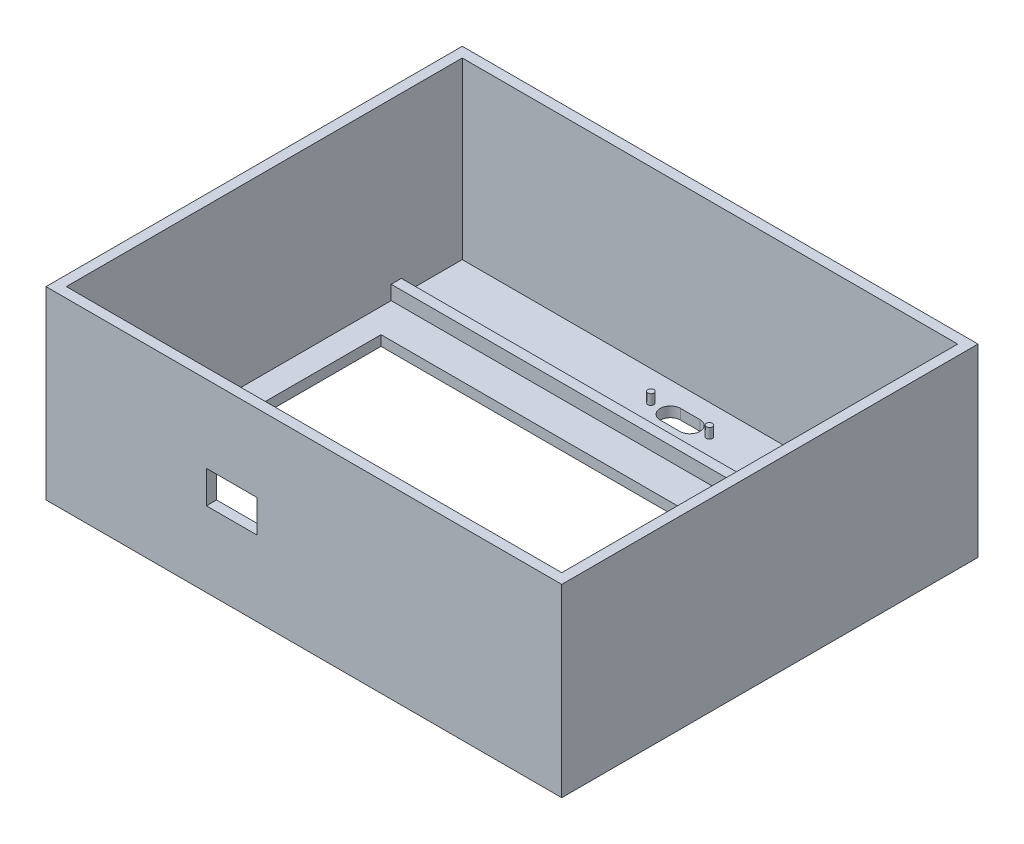
from build123d import *

# Parameters (mm, degrees)
SKETCH1_W           = 127
SKETCH1_H           = 85
BOSS_EXTRUDE1_DEPTH = 2.5
SKETCH2_W           = 127
SKETCH2_H           = 85
SKETCH2_W_2         = 122
SKETCH2_H_2         = 80
BOSS_EXTRUDE2_DEPTH = 38.5
SKETCH3_W           = 110
SKETCH3_H           = 68.5
CUT_EXTRUDE1_DEPTH  = 2.5
BOSS_EXTRUDE3_DEPTH = 15
SKETCH10_W          = 122
SKETCH10_H          = 2.5
CUT_EXTRUDE2_DEPTH  = 35
SKETCH11_W          = 127
SKETCH11_H          = 41
BOSS_EXTRUDE4_DEPTH = 2.5
CUT_EXTRUDE4_DEPTH  = 2.5
SKETCH14_W          = 15
SKETCH14_H          = 1
CUT_EXTRUDE5_DEPTH  = 1.5
SKETCH13_R          = 0.75
BOSS_EXTRUDE6_DEPTH = 2.5
SKETCH17_W          = 12.5
SKETCH17_H          = 8
CUT_EXTRUDE6_DEPTH  = 2.5
SKETCH19_W          = 127
SKETCH19_H          = 102.5
SKETCH19_W_2        = 122
SKETCH19_H_2        = 97.5
BOSS_EXTRUDE7_DEPTH = 4.5


with BuildPart() as part:
    # Sketch1 → Boss-Extrude1 (new body)
    with BuildSketch(Plane(origin=(0, 0, 0), x_dir=(1, 0, 0), z_dir=(0, 1, 0))):
        with Locations((63.5, 42.5)):
            Rectangle(SKETCH1_W, SKETCH1_H)
    extrude(amount=BOSS_EXTRUDE1_DEPTH)

    # Sketch2 → Boss-Extrude2 (add)
    with BuildSketch(Plane(origin=(0, 2.5, 0), x_dir=(1, 0, 0), z_dir=(0, 1, 0))):
        with Locations((63.5, 42.5)):
            Rectangle(SKETCH2_W, SKETCH2_H)
        with Locations((63.5, 42.5)):
            Rectangle(SKETCH2_W_2, SKETCH2_H_2, mode=Mode.SUBTRACT)
    extrude(amount=BOSS_EXTRUDE2_DEPTH)

    # Sketch3 → Cut-Extrude1 (cut)
    with BuildSketch(Plane(origin=(0, 0, 0), x_dir=(-1, 0, 0), z_dir=(0, -1, 0))):
        with Locations((-63.5, 39.75)):
            Rectangle(SKETCH3_W, SKETCH3_H)
    extrude(amount=-CUT_EXTRUDE1_DEPTH, mode=Mode.SUBTRACT)

    # Sketch9 → Boss-Extrude3 (add)
    with BuildSketch(Plane(origin=(0, 0, -85), x_dir=(-1, 0, 0), z_dir=(0, 0, -1))):
        Polygon((-127, 0), (0, 0), (0, 2.5), (0, 41), (-2.5, 41), (-2.5, 2.5), (-124.5, 2.5), (-124.5, 41), (-127, 41), (-127, 2.5), align=None)
    extrude(amount=BOSS_EXTRUDE3_DEPTH)

    # Sketch10 → Cut-Extrude2 (cut)
    with BuildSketch(Plane(origin=(0, 41, 0), x_dir=(1, 0, 0), z_dir=(0, 1, 0))):
        with Locations((63.5, 83.75)):
            Rectangle(SKETCH10_W, SKETCH10_H)
    extrude(amount=-CUT_EXTRUDE2_DEPTH, mode=Mode.SUBTRACT)

    # Sketch11 → Boss-Extrude4 (add)
    with BuildSketch(Plane(origin=(0, 0, -100), x_dir=(-1, 0, 0), z_dir=(0, 0, -1))):
        with Locations((-63.5, 20.5)):
            Rectangle(SKETCH11_W, SKETCH11_H)
    extrude(amount=BOSS_EXTRUDE4_DEPTH)

    # Sketch6 → Cut-Extrude4 (cut)
    with BuildSketch(Plane(origin=(0, 0, 0), x_dir=(-1, 0, 0), z_dir=(0, -1, 0))):
        with BuildLine():
            Line((-61.1, 90.153713072), (-65.9, 90.153713072))
            ThreePointArc((-65.9, 90.153713072), (-68.4, 92.653713072), (-65.9, 95.153713072))
            Line((-65.9, 95.153713072), (-61.1, 95.153713072))
            ThreePointArc((-61.1, 95.153713072), (-58.6, 92.653713072), (-61.1, 90.153713072))
        make_face()
    extrude(amount=-CUT_EXTRUDE4_DEPTH, mode=Mode.SUBTRACT)

    # Sketch14 → Cut-Extrude5 (cut)
    with BuildSketch(Plane(origin=(0, 2.5, 0), x_dir=(1, 0, 0), z_dir=(0, 1, 0))):
        with Locations((63.5, 86.653713072)):
            Rectangle(SKETCH14_W, SKETCH14_H)
    extrude(amount=-CUT_EXTRUDE5_DEPTH, mode=Mode.SUBTRACT)

    # Sketch13 → Boss-Extrude6 (add)
    with BuildSketch(Plane(origin=(0, 2.5, 0), x_dir=(1, 0, 0), z_dir=(0, 1, 0))):
        with Locations((56.3, 92.653713072)):
            Circle(SKETCH13_R)
        with Locations((70.7, 92.653713072)):
            Circle(SKETCH13_R)
    extrude(amount=BOSS_EXTRUDE6_DEPTH)

    # Sketch17 → Cut-Extrude6 (cut)
    with BuildSketch(Plane.XY):
        with Locations((45.75, 22.5)):
            Rectangle(SKETCH17_W, SKETCH17_H)
    extrude(amount=-CUT_EXTRUDE6_DEPTH, mode=Mode.SUBTRACT)

    # Sketch19 → Boss-Extrude7 (add)
    with BuildSketch(Plane(origin=(0, 41, 0), x_dir=(1, 0, 0), z_dir=(0, 1, 0))):
        with Locations((63.5, 51.25)):
            Rectangle(SKETCH19_W, SKETCH19_H)
        with Locations((63.5, 51.25)):
            Rectangle(SKETCH19_W_2, SKETCH19_H_2, mode=Mode.SUBTRACT)
    extrude(amount=BOSS_EXTRUDE7_DEPTH)


solid = part.part
